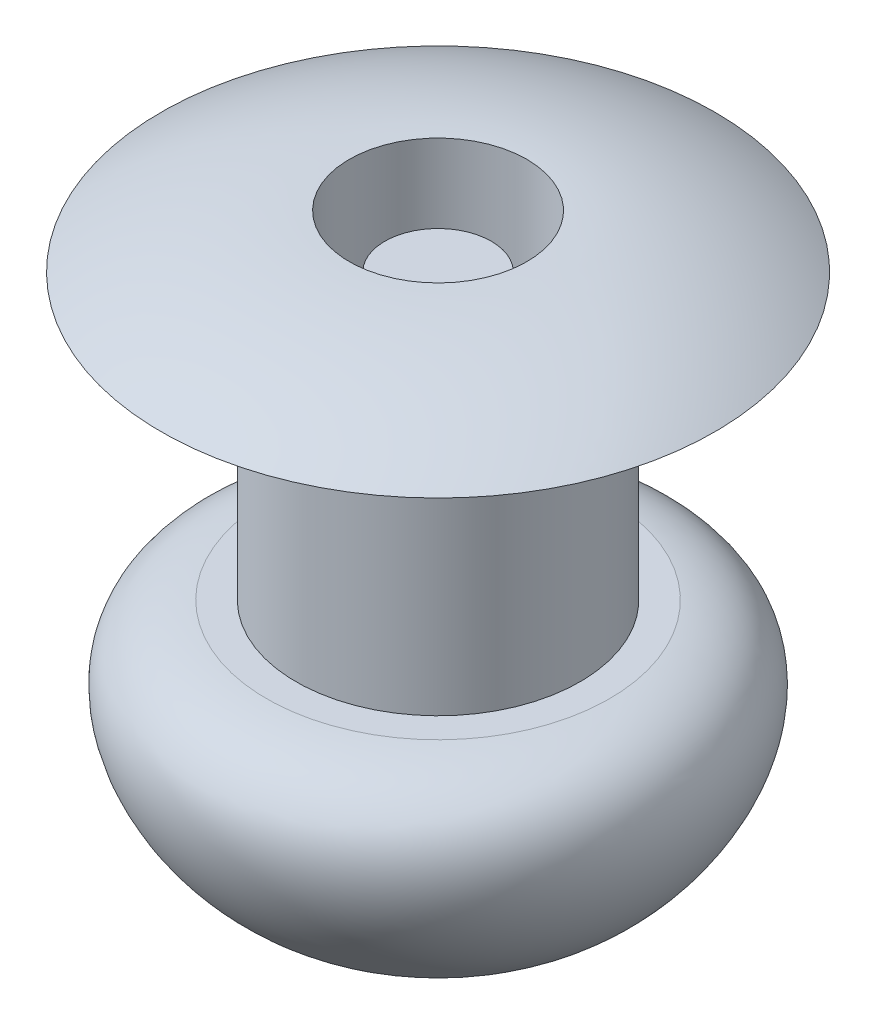
from build123d import *


with BuildPart() as part:
    # Szkic1 → Obrót1 (revolve)
    with BuildSketch(Plane(origin=(0, 0, 0), x_dir=(0, 0, -1), z_dir=(1, 0, 0))):
        with BuildLine():
            Line((0, 0), (0, -4))
            Line((0, -4), (0, -5.5))
            add(Edge.make_bspline(
                [(-0.956030427, -5.378190671), (-0.520263876, -5.5), (0, -5.5)],
                knots=[0.992852221, 0.992852221, 0.992852221, 1.570796327, 1.570796327, 1.570796327], degree=2, weights=[1, 0.958537313, 1]))
            add(Edge.make_bspline(
                [(-2.413891755, -4), (-3.858559437, -4.163296687), (-3.558358928, -6.322980362), (-0.971318098, -7.871940016), (-0.341145137, -5.79203191), (-0.956030427, -5.378190671)],
                knots=[0, 0, 0, 0, 0.454219308, 0.705200672, 1, 1, 1, 1], degree=3))
            Line((-2.413891755, -4), (-2, -4))
            Line((-2, -4), (-2, 0))
            Line((-2, 0), (-3.9, 0))
            ThreePointArc((-3.9, 0), (-2.627043935, 0.558888572), (-1.25, 0.75))
            Line((-1.25, 0.75), (-1.25, -4))
            Line((-1.25, -4), (-0.75, -4))
            Line((-0.75, -4), (-0.75, 0))
            Line((-0.75, 0), (0, 0))
        make_face()
    revolve(axis=Axis((0, 0, 0), (0, 1, 0)))


solid = part.part
